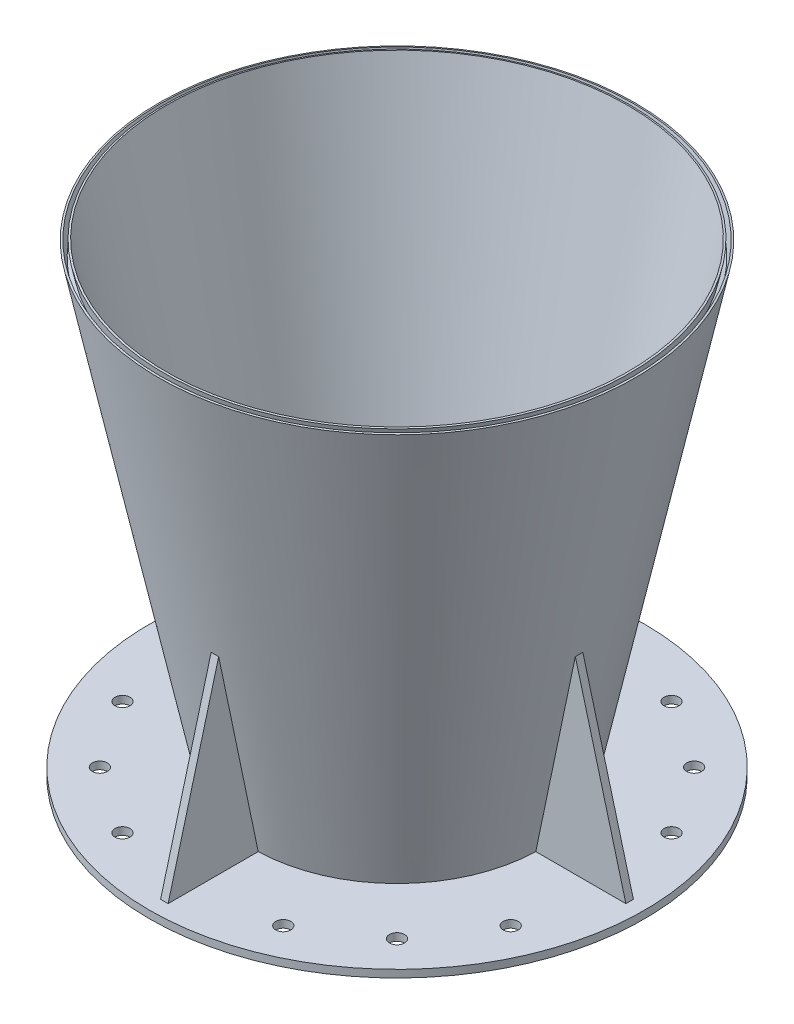
from build123d import *

# Parameters (mm, degrees)
RIB5_START          = -1.5875
RIB5_DEPTH          = 3.175
CIRPATTERN1_COUNT   = 4
BOSS_EXTRUDE1_REACH = 604.818
SKETCH4_R           = 50.8
SKETCH4_R_2         = 44.45
SKETCH4_3_R         = 44.45
CUT_EXTRUDE1_DEPTH  = 155.575
SKETCH16_R          = 47.625
SKETCH16_R_2        = 44.45
CUT_EXTRUDE8_DEPTH  = 165.1
BOSS_EXTRUDE2_START = 127
SKETCH10_R          = 53.975
SKETCH10_R_2        = 50.8
BOSS_EXTRUDE2_DEPTH = 127
RIB10_START         = -3.175
RIB10_DEPTH         = 3.175
SKETCH12_R          = 50.8
CUT_EXTRUDE4_DEPTH  = 9.525
SKETCH17_R          = 3.175
CUT_EXTRUDE9_DEPTH  = 3.175


with BuildPart() as part:
    # Sketch1 → Revolve-Thin1 (revolve)
    with BuildSketch(Plane.XY, mode=Mode.PRIVATE) as revolve_thin1_sk:
        Polygon((-104.775, 0), (-60.325, 0), (-158.75, 469.9), (-50.8, 469.9), (-50.8, 466.725), (-154.841065026, 466.725), (-56.416065026, -3.175), (-104.775, -3.175), align=None)
    revolve(revolve_thin1_sk.sketch.rotate(Axis((0, 0, 0), (0, 1, 0)), 270), axis=Axis((0, 0, 0), (0, 1, 0)))

    # Rib5: read off the stored shape, not the designer's step
    # Rib5 outline → Rib5 (add)
    with BuildSketch(Plane(origin=(0, 0, 0), x_dir=(0, 0, -1), z_dir=(1, 0, 0)).offset(RIB5_START)):
        with BuildLine():
            add(Edge.make_bspline(
                [(-60.304108235, -2e-09), (-60.337817831, 0.160880416), (-60.371527408, 0.321760839), (-62.968360223, 12.715265359), (-65.531376886, 24.947911788), (-71.07360722, 51.400397829), (-74.052795216, 65.620242821), (-77.031911205, 79.840102899)],
                knots=[1388.368707512, 1388.368707512, 1388.368707512, 1388.368707512, 1388.861829823, 1388.861829823, 1426.356632629, 1426.356632629, 1469.942363945, 1469.942363945, 1469.942363945, 1469.942363945], degree=3))
            Line((-77.031911205, 79.840102899), (-98.425, 0))
            Line((-98.425, 0), (-60.304108235, -2e-09))
        make_face()
    rib5 = extrude(amount=RIB5_DEPTH)

    # CirPattern1: Rib5 ×4 about axis
    cirpattern1_axis = Axis((0, 0, 0), (0, 1, 0))
    for i in range(1, CIRPATTERN1_COUNT):
        add(rib5.rotate(cirpattern1_axis, i * 360 / CIRPATTERN1_COUNT))

    # Sketch4 → Boss-Extrude1 (add, up to next)
    with BuildSketch(Plane(origin=(0, 41.317067623, 234.320734449), x_dir=(-1, 0, 0), z_dir=(0, 0.17364817766693072, 0.984807753012208)), mode=Mode.PRIVATE) as boss_extrude1_sk1:
        with Locations(Location((-89.350924276, -380.21116314, 0), (0, 0, 90))):
            Circle(SKETCH4_R)
        with Locations(Location((-89.350924276, -380.21116314, 0), (0, 0, 90))):
            Circle(SKETCH4_R_2, mode=Mode.SUBTRACT)
    boss_extrude1_tool1 = extrude(boss_extrude1_sk1.sketch, amount=-BOSS_EXTRUDE1_REACH, mode=Mode.PRIVATE) - part.part
    add(boss_extrude1_tool1.solids().sort_by_distance((89.350924, 464.365191, 159.725936))[0])

    # Sketch4<3> → Cut-Extrude1 (cut)
    with BuildSketch(Plane(origin=(0, 41.317067623, 234.320734449), x_dir=(-1, 0, 0), z_dir=(0, 0.17364817766693072, 0.984807753012208))):
        with Locations(Location((-89.350924276, -380.21116314, 0), (0, 0, 90))):
            Circle(SKETCH4_3_R)
    extrude(amount=-CUT_EXTRUDE1_DEPTH, mode=Mode.SUBTRACT)

    # Sketch16 → Cut-Extrude8 (cut)
    # profile 1 of 2: a face of its own
    with BuildSketch(Plane(origin=(0, 41.317067623, 234.320734449), x_dir=(1, 0, 0), z_dir=(0, 0.17364817766693058, 0.9848077530122081))):
        with Locations(Location((89.350924276, 380.21116314, 0), (0, 0, 270))):
            Circle(SKETCH16_R)
        with Locations((89.350924276, 380.21116314)):
            Circle(SKETCH16_R_2, mode=Mode.SUBTRACT)
    # profile 2 of 2: a face of its own
    with BuildSketch(Plane(origin=(0, 41.317067623, 234.320734449), x_dir=(1, 0, 0), z_dir=(0, 0.17364817766693058, 0.9848077530122081))):
        with Locations((89.350924276, 380.21116314)):
            Circle(SKETCH16_R_2)
    extrude(amount=-CUT_EXTRUDE8_DEPTH, mode=Mode.SUBTRACT)

    # Sketch10 → Boss-Extrude2 (add)
    with BuildSketch(Plane.XZ.offset(-466.725).offset(BOSS_EXTRUDE2_START)):
        with Locations(Location((0, 0, 0), (0, 0, 90))):
            Circle(SKETCH10_R)
        with Locations(Location((0, 0, 0), (0, 0, 270))):
            Circle(SKETCH10_R_2, mode=Mode.SUBTRACT)
    extrude(amount=-BOSS_EXTRUDE2_DEPTH)

    # Rib10: read off the stored shape, not the designer's step
    # Rib10 outline → Rib10 (add)
    with BuildSketch(Plane(origin=(41.275, 0, 0), x_dir=(0, 0, -1), z_dir=(1, 0, 0)).offset(RIB10_START)):
        with BuildLine():
            Line((-129.397511049, 371.475000111), (-34.780382402, 371.475))
            Line((-34.780382402, 371.475), (-34.780382402, 466.725))
            Line((-34.780382402, 466.725), (-150.08046179, 466.725000293))
            add(Edge.make_bspline(
                [(-129.397511049, 371.475000111), (-129.621022333, 372.498635621), (-129.844489601, 373.522280745), (-132.947477272, 387.73914033), (-135.819852259, 400.933914587), (-140.797597402, 423.849651078), (-142.905681683, 433.570024076), (-146.702544816, 451.101957641), (-148.392325081, 458.913301347), (-150.08046179, 466.725000293)],
                knots=[195.059408085, 195.059408085, 195.059408085, 195.059408085, 198.202667885, 198.202667885, 238.714059285, 238.714059285, 268.553076365, 268.553076365, 292.529147638, 292.529147638, 292.529147638, 292.529147638], degree=3))
        make_face()
    extrude(amount=RIB10_DEPTH)

    # Sketch12 → Cut-Extrude4 (cut)
    with BuildSketch(Plane(origin=(0, 41.317067623, 234.320734449), x_dir=(1, 0, 0), z_dir=(0, 0.17364817766693058, 0.9848077530122081))):
        with Locations(Location((89.350924276, 380.21116314, 0), (0, 0, 270))):
            Circle(SKETCH12_R)
    extrude(amount=-CUT_EXTRUDE4_DEPTH, mode=Mode.SUBTRACT)

    # Sketch17 → Cut-Extrude9 (cut)
    with BuildSketch(Plane.XZ.offset(3.175)):
        with Locations(Location((-62.861792847, 62.861792847, 0), (0, 0, 270))):
            Circle(SKETCH17_R)
        with Locations(Location((-34.020557137, 82.13289044, 0), (0, 0, 270))):
            Circle(SKETCH17_R)
        with Locations(Location((34.020557137, 82.13289044, 0), (0, 0, 270))):
            Circle(SKETCH17_R)
        with Locations(Location((62.861792847, 62.861792847, 0), (0, 0, 270))):
            Circle(SKETCH17_R)
        with Locations(Location((82.13289044, 34.020557137, 0), (0, 0, 270))):
            Circle(SKETCH17_R)
        with Locations(Location((82.13289044, -34.020557137, 0), (0, 0, 270))):
            Circle(SKETCH17_R)
        with Locations(Location((62.861792847, -62.861792847, 0), (0, 0, 270))):
            Circle(SKETCH17_R)
        with Locations(Location((34.020557137, -82.13289044, 0), (0, 0, 270))):
            Circle(SKETCH17_R)
        with Locations(Location((-34.020557137, -82.13289044, 0), (0, 0, 270))):
            Circle(SKETCH17_R)
        with Locations(Location((-62.861792847, -62.861792847, 0), (0, 0, 270))):
            Circle(SKETCH17_R)
        with Locations(Location((-82.13289044, -34.020557137, 0), (0, 0, 270))):
            Circle(SKETCH17_R)
        with Locations(Location((-82.13289044, 34.020557137, 0), (0, 0, 270))):
            Circle(SKETCH17_R)
    extrude(amount=-CUT_EXTRUDE9_DEPTH, mode=Mode.SUBTRACT)

    # Sketch18 → Cut-Revolve1 (revolve, cut)
    with BuildSketch(Plane.XY, mode=Mode.PRIVATE) as cut_revolve1_sk:
        Polygon((-100.755721907, 193.024091683), (-99.978831335, 193.186818762), (-98.677014702, 186.97169419), (-97.123233558, 187.297148348), (-98.425050192, 193.512272921), (-97.64815962, 193.675), (-154.841065026, 466.725), (-53.975, 339.725), (0, 339.725), (0, 469.9), (-158.75, 469.9), align=None)
    revolve(cut_revolve1_sk.sketch.rotate(Axis((0, 0, 0), (0, 1, 0)), 270), axis=Axis((0, 0, 0), (0, 1, 0)), mode=Mode.SUBTRACT)


with BuildPart() as cut_revolve1_kept_piece:
    # of the separate pieces the step leaves, the one the design keeps (cut_revolve1_pieces_kept)
    add(part.part.solids().sort_by_distance((0, 0, -104.775))[0])


solid = cut_revolve1_kept_piece.part
